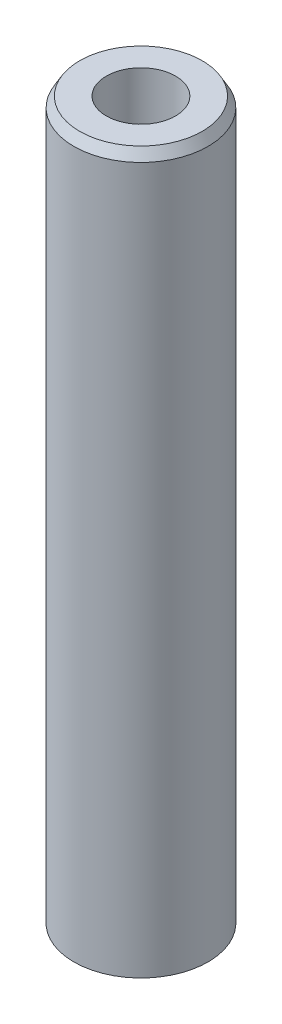
from build123d import *
from OCP.BRepFilletAPI import BRepFilletAPI_MakeChamfer

# Parameters (mm, degrees)
SKETCH1_R           = 17.5
BOSS_EXTRUDE1_DEPTH = 188.355232041
SKETCH2_R           = 9.027635407
CUT_EXTRUDE1_DEPTH  = 190.974191503
CHAMFER1_SIZE       = 2.637576882
CHAMFER1_SIZE2      = 1.522805723


with BuildPart() as part:
    # Sketch1 → Boss-Extrude1 (new body)
    with BuildSketch(Plane(origin=(0, 0, 0), x_dir=(1, 0, 0), z_dir=(0, 1, 0))):
        Circle(SKETCH1_R)
    extrude(amount=BOSS_EXTRUDE1_DEPTH)

    # Sketch2 → Cut-Extrude1 (cut, through all)
    with BuildSketch(Plane(origin=(0, 0, 0), x_dir=(1, 0, 0), z_dir=(0, 1, 0))):
        Circle(SKETCH2_R)
    extrude(amount=CUT_EXTRUDE1_DEPTH, mode=Mode.SUBTRACT)

    # Chamfer1: one chamfer whose edges measure the first distance from different faces: ONE call of the kernel's chamfer builder (chamfer() names one face for all edges)
    chamfer1_edges_1 = [part.edges().sort_by_distance(p)[0] for p in [
        (-17.5, 188.355232041, 0),
    ]]
    chamfer1_side_1 = [part.faces().sort_by_distance(p)[0] for p in [
        (-17.5, 94.177616021, 0),
    ]]
    chamfer1_edges_2 = [part.edges().sort_by_distance(p)[0] for p in [
        (-17.5, 0, 0),
    ]]
    chamfer1_side_2 = [part.faces().sort_by_distance(p)[0] for p in [
        (-17.005025253, 0, 0),
    ]]
    chamfer1 = BRepFilletAPI_MakeChamfer(part.part.solid().wrapped)
    for e in chamfer1_edges_1:
        chamfer1.Add(CHAMFER1_SIZE, CHAMFER1_SIZE2, e.wrapped, chamfer1_side_1[0].wrapped)  # the first distance lies on this face
    for e in chamfer1_edges_2:
        chamfer1.Add(CHAMFER1_SIZE, CHAMFER1_SIZE2, e.wrapped, chamfer1_side_2[0].wrapped)  # the first distance lies on this face
    add(Compound.cast(chamfer1.Shape()), mode=Mode.REPLACE)


solid = part.part
